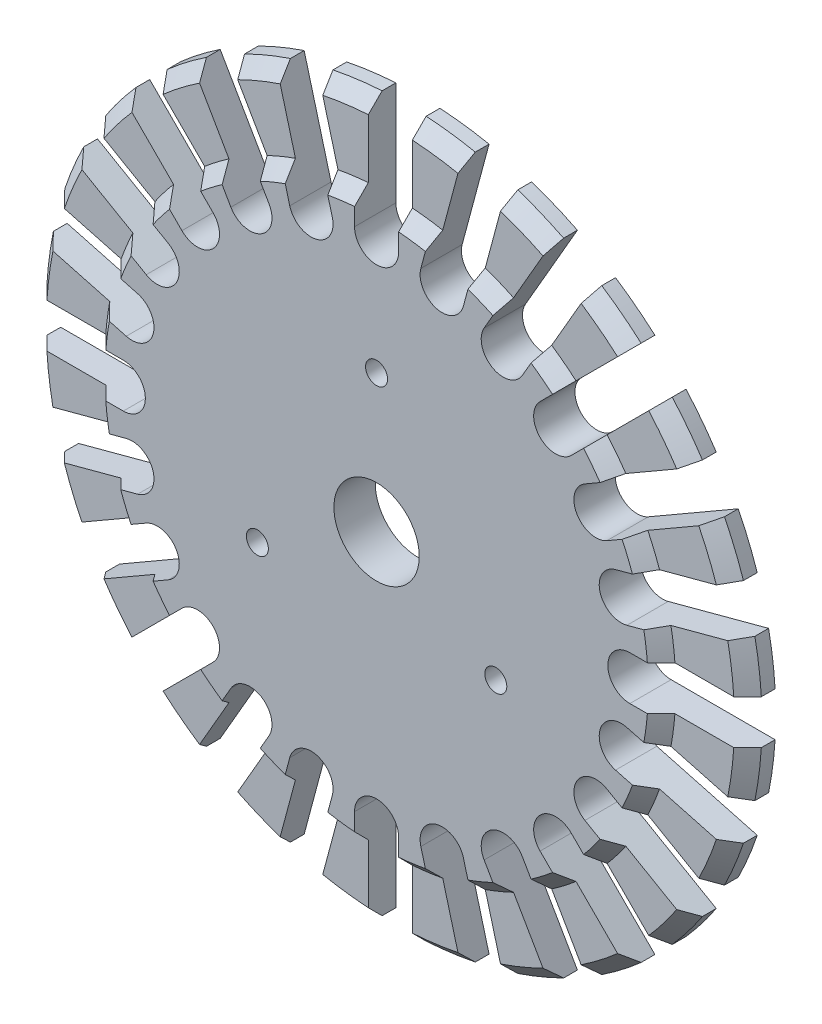
from build123d import *

# Parameters (mm, degrees)
ESBO_O1_R                = 26
RESSALTO_EXTRUS_O1_DEPTH = 2
CORTE_EXTRUS_O1_DEPTH    = 37.823905279
ESBO_O8_R                = 20.736193701
RESSALTO_EXTRUS_O2_DEPTH = 1
CORTE_EXTRUS_O2_DEPTH    = 37.754319474
ESBO_O10_R               = 3.1
CORTE_EXTRUS_O3_DEPTH    = 37.822275867
FURO_ROSCADO_DE_M21_D    = 1.6
ESBO_O23_R               = 33.041855185
CORTE_EXTRUS_O4_DEPTH    = 37.754319474


with BuildPart() as part:
    # Esboço1 → Ressalto-extrusão1 (new body)
    with BuildSketch(Plane.XY):
        Circle(ESBO_O1_R)
    extrude(amount=RESSALTO_EXTRUS_O1_DEPTH)

    # Chanfro1: read off the stored shape, not the designer's step
    # Chanfro1 outline → Chanfro1 (revolve, cut)
    with BuildSketch(Plane.XZ):
        Polygon((26, 2), (25, 2), (26, 1), align=None)
    revolve(axis=Axis((0, 0, 0), (0, 0, 1)), mode=Mode.SUBTRACT)

    # Esboço3 → Corte-extrusão1 (cut, through all)
    with BuildSketch(Plane(origin=(0, 0, 0), x_dir=(-1, 0, 0), z_dir=(0, 0, -1))):
        with BuildLine():
            ThreePointArc((18.4, 1.6), (16.8, 0), (18.4, -1.6))
            Line((18.4, -1.6), (25.950722533, -1.6))
            ThreePointArc((25.950722533, -1.6), (25.987677713, -0.800379327), (26, 0))
            ThreePointArc((26, 0), (25.987677713, 0.800379327), (25.950722533, 1.6))
            Line((25.950722533, 1.6), (18.4, 1.6))
        make_face()
        with BuildLine():
            ThreePointArc((24.652362634, -8.262022548), (25.114071484, -6.729295173), (25.480583578, -5.171059904))
            Line((25.480583578, -5.171059904), (18.187145676, -3.216789108))
            ThreePointArc((18.187145676, -3.216789108), (16.227553882, -4.348159958), (17.358924732, -6.307751752))
            Line((17.358924732, -6.307751752), (24.652362634, -8.262022548))
        make_face()
        with BuildLine():
            ThreePointArc((21.67398496, -14.361001913), (22.516660498, -13), (23.27398496, -11.589720621))
            Line((23.27398496, -11.589720621), (16.73486743, -7.814359354))
            ThreePointArc((16.73486743, -7.814359354), (14.549226784, -8.4), (15.13486743, -10.585640646))
            Line((15.13486743, -10.585640646), (21.67398496, -14.361001913))
        make_face()
        with BuildLine():
            ThreePointArc((17.21856103, -19.48130273), (18.384776311, -18.384776311), (19.48130273, -17.21856103))
            Line((19.48130273, -17.21856103), (14.142135624, -11.879393924))
            ThreePointArc((14.142135624, -11.879393924), (11.879393924, -11.879393924), (11.879393924, -14.142135624))
            Line((11.879393924, -14.142135624), (17.21856103, -19.48130273))
        make_face()
        with BuildLine():
            ThreePointArc((11.589720621, -23.27398496), (13, -22.516660498), (14.361001913, -21.67398496))
            Line((14.361001913, -21.67398496), (10.585640646, -15.13486743))
            ThreePointArc((10.585640646, -15.13486743), (8.4, -14.549226784), (7.814359354, -16.73486743))
            Line((7.814359354, -16.73486743), (11.589720621, -23.27398496))
        make_face()
        with BuildLine():
            ThreePointArc((5.171059904, -25.480583578), (6.729295173, -25.114071484), (8.262022548, -24.652362634))
            Line((8.262022548, -24.652362634), (6.307751752, -17.358924732))
            ThreePointArc((6.307751752, -17.358924732), (4.348159958, -16.227553882), (3.216789108, -18.187145676))
            Line((3.216789108, -18.187145676), (5.171059904, -25.480583578))
        make_face()
        with BuildLine():
            ThreePointArc((-1.6, -25.950722533), (0, -26), (1.6, -25.950722533))
            Line((1.6, -25.950722533), (1.6, -18.4))
            ThreePointArc((1.6, -18.4), (0, -16.8), (-1.6, -18.4))
            Line((-1.6, -18.4), (-1.6, -25.950722533))
        make_face()
        with BuildLine():
            ThreePointArc((-8.262022548, -24.652362634), (-6.729295173, -25.114071484), (-5.171059904, -25.480583578))
            Line((-5.171059904, -25.480583578), (-3.216789108, -18.187145676))
            ThreePointArc((-3.216789108, -18.187145676), (-4.348159958, -16.227553882), (-6.307751752, -17.358924732))
            Line((-6.307751752, -17.358924732), (-8.262022548, -24.652362634))
        make_face()
        with BuildLine():
            ThreePointArc((-14.361001913, -21.67398496), (-13, -22.516660498), (-11.589720621, -23.27398496))
            Line((-11.589720621, -23.27398496), (-7.814359354, -16.73486743))
            ThreePointArc((-7.814359354, -16.73486743), (-8.4, -14.549226784), (-10.585640646, -15.13486743))
            Line((-10.585640646, -15.13486743), (-14.361001913, -21.67398496))
        make_face()
        with BuildLine():
            ThreePointArc((-19.48130273, -17.21856103), (-18.384776311, -18.384776311), (-17.21856103, -19.48130273))
            Line((-17.21856103, -19.48130273), (-11.879393924, -14.142135624))
            ThreePointArc((-11.879393924, -14.142135624), (-11.879393924, -11.879393924), (-14.142135624, -11.879393924))
            Line((-14.142135624, -11.879393924), (-19.48130273, -17.21856103))
        make_face()
        with BuildLine():
            ThreePointArc((-23.27398496, -11.589720621), (-22.516660498, -13), (-21.67398496, -14.361001913))
            Line((-21.67398496, -14.361001913), (-15.13486743, -10.585640646))
            ThreePointArc((-15.13486743, -10.585640646), (-14.549226784, -8.4), (-16.73486743, -7.814359354))
            Line((-16.73486743, -7.814359354), (-23.27398496, -11.589720621))
        make_face()
        with BuildLine():
            ThreePointArc((-25.480583578, -5.171059904), (-25.114071484, -6.729295173), (-24.652362634, -8.262022548))
            Line((-24.652362634, -8.262022548), (-17.358924732, -6.307751752))
            ThreePointArc((-17.358924732, -6.307751752), (-16.227553882, -4.348159958), (-18.187145676, -3.216789108))
            Line((-18.187145676, -3.216789108), (-25.480583578, -5.171059904))
        make_face()
        with BuildLine():
            ThreePointArc((-25.950722533, 1.6), (-26, 0), (-25.950722533, -1.6))
            Line((-25.950722533, -1.6), (-18.4, -1.6))
            ThreePointArc((-18.4, -1.6), (-16.8, 0), (-18.4, 1.6))
            Line((-18.4, 1.6), (-25.950722533, 1.6))
        make_face()
        with BuildLine():
            Line((-15.13486743, 10.585640646), (-21.67398496, 14.361001913))
            ThreePointArc((-21.67398496, 14.361001913), (-22.516660498, 13), (-23.27398496, 11.589720621))
            Line((-23.27398496, 11.589720621), (-16.73486743, 7.814359354))
            ThreePointArc((-16.73486743, 7.814359354), (-14.549226784, 8.4), (-15.13486743, 10.585640646))
        make_face()
        with BuildLine():
            Line((-17.358924732, 6.307751752), (-24.652362634, 8.262022548))
            ThreePointArc((-24.652362634, 8.262022548), (-25.114071484, 6.729295173), (-25.480583578, 5.171059904))
            Line((-25.480583578, 5.171059904), (-18.187145676, 3.216789108))
            ThreePointArc((-18.187145676, 3.216789108), (-16.227553882, 4.348159958), (-17.358924732, 6.307751752))
        make_face()
        with BuildLine():
            Line((-11.879393924, 14.142135624), (-17.21856103, 19.48130273))
            ThreePointArc((-17.21856103, 19.48130273), (-18.384776311, 18.384776311), (-19.48130273, 17.21856103))
            Line((-19.48130273, 17.21856103), (-14.142135624, 11.879393924))
            ThreePointArc((-14.142135624, 11.879393924), (-11.879393924, 11.879393924), (-11.879393924, 14.142135624))
        make_face()
        with BuildLine():
            Line((-7.814359354, 16.73486743), (-11.589720621, 23.27398496))
            ThreePointArc((-11.589720621, 23.27398496), (-13, 22.516660498), (-14.361001913, 21.67398496))
            Line((-14.361001913, 21.67398496), (-10.585640646, 15.13486743))
            ThreePointArc((-10.585640646, 15.13486743), (-8.4, 14.549226784), (-7.814359354, 16.73486743))
        make_face()
        with BuildLine():
            Line((1.6, 18.4), (1.6, 25.950722533))
            ThreePointArc((1.6, 25.950722533), (0, 26), (-1.6, 25.950722533))
            Line((-1.6, 25.950722533), (-1.6, 18.4))
            ThreePointArc((-1.6, 18.4), (0, 16.8), (1.6, 18.4))
        make_face()
        with BuildLine():
            Line((6.307751752, 17.358924732), (8.262022548, 24.652362634))
            ThreePointArc((8.262022548, 24.652362634), (6.729295173, 25.114071484), (5.171059904, 25.480583578))
            Line((5.171059904, 25.480583578), (3.216789108, 18.187145676))
            ThreePointArc((3.216789108, 18.187145676), (4.348159958, 16.227553882), (6.307751752, 17.358924732))
        make_face()
        with BuildLine():
            Line((10.585640646, 15.13486743), (14.361001913, 21.67398496))
            ThreePointArc((14.361001913, 21.67398496), (13, 22.516660498), (11.589720621, 23.27398496))
            Line((11.589720621, 23.27398496), (7.814359354, 16.73486743))
            ThreePointArc((7.814359354, 16.73486743), (8.4, 14.549226784), (10.585640646, 15.13486743))
        make_face()
        with BuildLine():
            Line((14.142135624, 11.879393924), (19.48130273, 17.21856103))
            ThreePointArc((19.48130273, 17.21856103), (18.384776311, 18.384776311), (17.21856103, 19.48130273))
            Line((17.21856103, 19.48130273), (11.879393924, 14.142135624))
            ThreePointArc((11.879393924, 14.142135624), (11.879393924, 11.879393924), (14.142135624, 11.879393924))
        make_face()
        with BuildLine():
            Line((18.187145676, 3.216789108), (25.480583578, 5.171059904))
            ThreePointArc((25.480583578, 5.171059904), (25.114071484, 6.729295173), (24.652362634, 8.262022548))
            Line((24.652362634, 8.262022548), (17.358924732, 6.307751752))
            ThreePointArc((17.358924732, 6.307751752), (16.227553882, 4.348159958), (18.187145676, 3.216789108))
        make_face()
        with BuildLine():
            Line((16.73486743, 7.814359354), (23.27398496, 11.589720621))
            ThreePointArc((23.27398496, 11.589720621), (22.516660498, 13), (21.67398496, 14.361001913))
            Line((21.67398496, 14.361001913), (15.13486743, 10.585640646))
            ThreePointArc((15.13486743, 10.585640646), (14.549226784, 8.4), (16.73486743, 7.814359354))
        make_face()
        with BuildLine():
            Line((-3.216789108, 18.187145676), (-5.171059904, 25.480583578))
            ThreePointArc((-5.171059904, 25.480583578), (-6.729295173, 25.114071484), (-8.262022548, 24.652362634))
            Line((-8.262022548, 24.652362634), (-6.307751752, 17.358924732))
            ThreePointArc((-6.307751752, 17.358924732), (-4.348159958, 16.227553882), (-3.216789108, 18.187145676))
        make_face()
    extrude(amount=-CORTE_EXTRUS_O1_DEPTH, mode=Mode.SUBTRACT)

    # Esboço8 → Ressalto-extrusão2 (add)
    with BuildSketch(Plane.XY.offset(2)):
        with Locations(Location((0, 0, 0), (0, 0, 175.574672098))):
            Circle(ESBO_O8_R)
    extrude(amount=RESSALTO_EXTRUS_O2_DEPTH)

    # Chanfro2: read off the stored shape, not the designer's step
    # Chanfro2 outline → Chanfro2 (revolve, cut)
    with BuildSketch(Plane.XZ):
        Polygon((20.736193701, 3), (19.736193701, 3), (20.736193701, 2), align=None)
    revolve(axis=Axis((0, 0, 0), (0, 0, 1)), mode=Mode.SUBTRACT)

    # Esboço9 → Corte-extrusão2 (cut, through all)
    with BuildSketch(Plane(origin=(0, 0, 2), x_dir=(-1, 0, 0), z_dir=(0, 0, -1))):
        with BuildLine():
            ThreePointArc((-11.722827512, -17.104532859), (-9.537186866, -16.518892213), (-8.95154622, -18.704532859))
            ThreePointArc((-8.95154622, -18.704532859), (-10.36809685, -17.958070523), (-11.722827512, -17.104532859))
        make_face()
        with BuildLine():
            ThreePointArc((-15.750360712, -13.487619013), (-13.487619013, -13.487619013), (-13.487619013, -15.750360712))
            ThreePointArc((-13.487619013, -15.750360712), (-14.662703182, -14.662703182), (-15.750360712, -13.487619013))
        make_face()
        with BuildLine():
            ThreePointArc((-18.704532859, -8.95154622), (-16.518892213, -9.537186866), (-17.104532859, -11.722827512))
            ThreePointArc((-17.104532859, -11.722827512), (-17.958070523, -10.36809685), (-18.704532859, -8.95154622))
        make_face()
        with BuildLine():
            ThreePointArc((-20.384022002, -3.805440345), (-18.424430208, -4.936811195), (-19.555801058, -6.896402989))
            ThreePointArc((-19.555801058, -6.896402989), (-20.029625035, -5.366921853), (-20.384022002, -3.805440345))
        make_face()
        with BuildLine():
            ThreePointArc((-20.674373732, 1.6), (-19.074373732, 0), (-20.674373732, -1.6))
            ThreePointArc((-20.674373732, -1.6), (-20.736193701, 0), (-20.674373732, 1.6))
        make_face()
        with BuildLine():
            ThreePointArc((-19.555801058, 6.896402989), (-18.424430208, 4.936811195), (-20.384022002, 3.805440345))
            ThreePointArc((-20.384022002, 3.805440345), (-20.029625035, 5.366921853), (-19.555801058, 6.896402989))
        make_face()
        with BuildLine():
            ThreePointArc((-17.104532859, 11.722827512), (-16.518892213, 9.537186866), (-18.704532859, 8.95154622))
            ThreePointArc((-18.704532859, 8.95154622), (-17.958070523, 10.36809685), (-17.104532859, 11.722827512))
        make_face()
        with BuildLine():
            ThreePointArc((-13.487619013, 15.750360712), (-13.487619013, 13.487619013), (-15.750360712, 13.487619013))
            ThreePointArc((-15.750360712, 13.487619013), (-14.662703182, 14.662703182), (-13.487619013, 15.750360712))
        make_face()
        with BuildLine():
            ThreePointArc((-8.95154622, 18.704532859), (-9.537186866, 16.518892213), (-11.722827512, 17.104532859))
            ThreePointArc((-11.722827512, 17.104532859), (-10.36809685, 17.958070523), (-8.95154622, 18.704532859))
        make_face()
        with BuildLine():
            ThreePointArc((-3.805440345, 20.384022002), (-4.936811195, 18.424430208), (-6.896402989, 19.555801058))
            ThreePointArc((-6.896402989, 19.555801058), (-5.366921853, 20.029625035), (-3.805440345, 20.384022002))
        make_face()
        with BuildLine():
            ThreePointArc((1.6, 20.674373732), (0, 19.074373732), (-1.6, 20.674373732))
            ThreePointArc((-1.6, 20.674373732), (0, 20.736193701), (1.6, 20.674373732))
        make_face()
        with BuildLine():
            ThreePointArc((6.896402989, 19.555801058), (4.936811195, 18.424430208), (3.805440345, 20.384022002))
            ThreePointArc((3.805440345, 20.384022002), (5.366921853, 20.029625035), (6.896402989, 19.555801058))
        make_face()
        with BuildLine():
            ThreePointArc((11.722827512, 17.104532859), (9.537186866, 16.518892213), (8.95154622, 18.704532859))
            ThreePointArc((8.95154622, 18.704532859), (10.36809685, 17.958070523), (11.722827512, 17.104532859))
        make_face()
        with BuildLine():
            ThreePointArc((15.750360712, 13.487619013), (13.487619013, 13.487619013), (13.487619013, 15.750360712))
            ThreePointArc((13.487619013, 15.750360712), (14.662703182, 14.662703182), (15.750360712, 13.487619013))
        make_face()
        with BuildLine():
            ThreePointArc((18.704532859, 8.95154622), (16.518892213, 9.537186866), (17.104532859, 11.722827512))
            ThreePointArc((17.104532859, 11.722827512), (17.958070523, 10.36809685), (18.704532859, 8.95154622))
        make_face()
        with BuildLine():
            ThreePointArc((20.384022002, 3.805440345), (18.424430208, 4.936811195), (19.555801058, 6.896402989))
            ThreePointArc((19.555801058, 6.896402989), (20.029625035, 5.366921853), (20.384022002, 3.805440345))
        make_face()
        with BuildLine():
            ThreePointArc((20.674373732, -1.6), (19.074373732, 0), (20.674373732, 1.6))
            ThreePointArc((20.674373732, 1.6), (20.736193701, 0), (20.674373732, -1.6))
        make_face()
        with BuildLine():
            ThreePointArc((19.555801058, -6.896402989), (18.424430208, -4.936811195), (20.384022002, -3.805440345))
            ThreePointArc((20.384022002, -3.805440345), (20.029625035, -5.366921853), (19.555801058, -6.896402989))
        make_face()
        with BuildLine():
            ThreePointArc((17.104532859, -11.722827512), (16.518892213, -9.537186866), (18.704532859, -8.95154622))
            ThreePointArc((18.704532859, -8.95154622), (17.958070523, -10.36809685), (17.104532859, -11.722827512))
        make_face()
        with BuildLine():
            ThreePointArc((13.487619013, -15.750360712), (13.487619013, -13.487619013), (15.750360712, -13.487619013))
            ThreePointArc((15.750360712, -13.487619013), (14.662703182, -14.662703182), (13.487619013, -15.750360712))
        make_face()
        with BuildLine():
            ThreePointArc((8.95154622, -18.704532859), (9.537186866, -16.518892213), (11.722827512, -17.104532859))
            ThreePointArc((11.722827512, -17.104532859), (10.36809685, -17.958070523), (8.95154622, -18.704532859))
        make_face()
        with BuildLine():
            ThreePointArc((3.805440345, -20.384022002), (4.936811195, -18.424430208), (6.896402989, -19.555801058))
            ThreePointArc((6.896402989, -19.555801058), (5.366921853, -20.029625035), (3.805440345, -20.384022002))
        make_face()
        with BuildLine():
            ThreePointArc((-1.6, -20.674373732), (0, -19.074373732), (1.6, -20.674373732))
            ThreePointArc((1.6, -20.674373732), (0, -20.736193701), (-1.6, -20.674373732))
        make_face()
        with BuildLine():
            ThreePointArc((-6.896402989, -19.555801058), (-4.936811195, -18.424430208), (-3.805440345, -20.384022002))
            ThreePointArc((-3.805440345, -20.384022002), (-5.366921853, -20.029625035), (-6.896402989, -19.555801058))
        make_face()
    extrude(amount=-CORTE_EXTRUS_O2_DEPTH, mode=Mode.SUBTRACT)

    # Esboço10 → Corte-extrusão3 (cut, through all)
    with BuildSketch(Plane.XY.offset(3)):
        Circle(ESBO_O10_R)
    extrude(amount=-CORTE_EXTRUS_O3_DEPTH, mode=Mode.SUBTRACT)

    # Furo roscado de M21 (through all)
    with Locations(Plane(origin=(-8.660254038, -5, 3), x_dir=(1, 0, 0), z_dir=(0, 0, 1))):
        with Locations((0, 0), (8.660254038, 15), (17.320508076, 0)):
            Hole(FURO_ROSCADO_DE_M21_D / 2)

    # Esboço23 → Corte-extrusão4 (cut, through all)
    with BuildSketch(Plane(origin=(0, 0, 2), x_dir=(-1, 0, 0), z_dir=(0, 0, -1))):
        Circle(ESBO_O23_R)
        with BuildLine():
            Line((-18.187145676, 3.216789108), (-25.480583578, 5.171059904))
            ThreePointArc((-25.480583578, 5.171059904), (-25.777566396, 3.393680998), (-25.950722533, 1.6))
            Line((-25.950722533, 1.6), (-18.4, 1.6))
            ThreePointArc((-18.4, 1.6), (-16.8, 0), (-18.4, -1.6))
            Line((-18.4, -1.6), (-25.950722533, -1.6))
            ThreePointArc((-25.950722533, -1.6), (-25.777566396, -3.393680998), (-25.480583578, -5.171059904))
            Line((-25.480583578, -5.171059904), (-18.187145676, -3.216789108))
            ThreePointArc((-18.187145676, -3.216789108), (-16.227553882, -4.348159958), (-17.358924732, -6.307751752))
            Line((-17.358924732, -6.307751752), (-24.652362634, -8.262022548))
            ThreePointArc((-24.652362634, -8.262022548), (-24.020867845, -9.949769241), (-23.27398496, -11.589720621))
            Line((-23.27398496, -11.589720621), (-16.73486743, -7.814359354))
            ThreePointArc((-16.73486743, -7.814359354), (-14.549226784, -8.4), (-15.13486743, -10.585640646))
            Line((-15.13486743, -10.585640646), (-21.67398496, -14.361001913))
            ThreePointArc((-21.67398496, -14.361001913), (-20.627186848, -15.827797154), (-19.48130273, -17.21856103))
            Line((-19.48130273, -17.21856103), (-14.142135624, -11.879393924))
            ThreePointArc((-14.142135624, -11.879393924), (-11.879393924, -11.879393924), (-11.879393924, -14.142135624))
            Line((-11.879393924, -14.142135624), (-17.21856103, -19.48130273))
            ThreePointArc((-17.21856103, -19.48130273), (-15.827797154, -20.627186848), (-14.361001913, -21.67398496))
            Line((-14.361001913, -21.67398496), (-10.585640646, -15.13486743))
            ThreePointArc((-10.585640646, -15.13486743), (-8.4, -14.549226784), (-7.814359354, -16.73486743))
            Line((-7.814359354, -16.73486743), (-11.589720621, -23.27398496))
            ThreePointArc((-11.589720621, -23.27398496), (-9.949769241, -24.020867845), (-8.262022548, -24.652362634))
            Line((-8.262022548, -24.652362634), (-6.307751752, -17.358924732))
            ThreePointArc((-6.307751752, -17.358924732), (-4.348159958, -16.227553882), (-3.216789108, -18.187145676))
            Line((-3.216789108, -18.187145676), (-5.171059904, -25.480583578))
            ThreePointArc((-5.171059904, -25.480583578), (-3.393680998, -25.777566396), (-1.6, -25.950722533))
            Line((-1.6, -25.950722533), (-1.6, -18.4))
            ThreePointArc((-1.6, -18.4), (0, -16.8), (1.6, -18.4))
            Line((1.6, -18.4), (1.6, -25.950722533))
            ThreePointArc((1.6, -25.950722533), (3.393680998, -25.777566396), (5.171059904, -25.480583578))
            Line((5.171059904, -25.480583578), (3.216789108, -18.187145676))
            ThreePointArc((3.216789108, -18.187145676), (4.348159958, -16.227553882), (6.307751752, -17.358924732))
            Line((6.307751752, -17.358924732), (8.262022548, -24.652362634))
            ThreePointArc((8.262022548, -24.652362634), (9.949769241, -24.020867845), (11.589720621, -23.27398496))
            Line((11.589720621, -23.27398496), (7.814359354, -16.73486743))
            ThreePointArc((7.814359354, -16.73486743), (8.4, -14.549226784), (10.585640646, -15.13486743))
            Line((10.585640646, -15.13486743), (14.361001913, -21.67398496))
            ThreePointArc((14.361001913, -21.67398496), (15.827797154, -20.627186848), (17.21856103, -19.48130273))
            Line((17.21856103, -19.48130273), (11.879393924, -14.142135624))
            ThreePointArc((11.879393924, -14.142135624), (11.879393924, -11.879393924), (14.142135624, -11.879393924))
            Line((14.142135624, -11.879393924), (19.48130273, -17.21856103))
            ThreePointArc((19.48130273, -17.21856103), (20.627186848, -15.827797154), (21.67398496, -14.361001913))
            Line((21.67398496, -14.361001913), (15.13486743, -10.585640646))
            ThreePointArc((15.13486743, -10.585640646), (14.549226784, -8.4), (16.73486743, -7.814359354))
            Line((16.73486743, -7.814359354), (23.27398496, -11.589720621))
            ThreePointArc((23.27398496, -11.589720621), (24.020867845, -9.949769241), (24.652362634, -8.262022548))
            Line((24.652362634, -8.262022548), (17.358924732, -6.307751752))
            ThreePointArc((17.358924732, -6.307751752), (16.227553882, -4.348159958), (18.187145676, -3.216789108))
            Line((18.187145676, -3.216789108), (25.480583578, -5.171059904))
            ThreePointArc((25.480583578, -5.171059904), (25.777566396, -3.393680998), (25.950722533, -1.6))
            Line((25.950722533, -1.6), (18.4, -1.6))
            ThreePointArc((18.4, -1.6), (16.8, 0), (18.4, 1.6))
            Line((18.4, 1.6), (25.950722533, 1.6))
            ThreePointArc((25.950722533, 1.6), (25.777566396, 3.393680998), (25.480583578, 5.171059904))
            Line((25.480583578, 5.171059904), (18.187145676, 3.216789108))
            ThreePointArc((18.187145676, 3.216789108), (16.227553882, 4.348159958), (17.358924732, 6.307751752))
            Line((17.358924732, 6.307751752), (24.652362634, 8.262022548))
            ThreePointArc((24.652362634, 8.262022548), (24.020867845, 9.949769241), (23.27398496, 11.589720621))
            Line((23.27398496, 11.589720621), (16.73486743, 7.814359354))
            ThreePointArc((16.73486743, 7.814359354), (14.549226784, 8.4), (15.13486743, 10.585640646))
            Line((15.13486743, 10.585640646), (21.67398496, 14.361001913))
            ThreePointArc((21.67398496, 14.361001913), (20.627186848, 15.827797154), (19.48130273, 17.21856103))
            Line((19.48130273, 17.21856103), (14.142135624, 11.879393924))
            ThreePointArc((14.142135624, 11.879393924), (11.879393924, 11.879393924), (11.879393924, 14.142135624))
            Line((11.879393924, 14.142135624), (17.21856103, 19.48130273))
            ThreePointArc((17.21856103, 19.48130273), (15.827797154, 20.627186848), (14.361001913, 21.67398496))
            Line((14.361001913, 21.67398496), (10.585640646, 15.13486743))
            ThreePointArc((10.585640646, 15.13486743), (8.4, 14.549226784), (7.814359354, 16.73486743))
            Line((7.814359354, 16.73486743), (11.589720621, 23.27398496))
            ThreePointArc((11.589720621, 23.27398496), (9.949769241, 24.020867845), (8.262022548, 24.652362634))
            Line((8.262022548, 24.652362634), (6.307751752, 17.358924732))
            ThreePointArc((6.307751752, 17.358924732), (4.348159958, 16.227553882), (3.216789108, 18.187145676))
            Line((3.216789108, 18.187145676), (5.171059904, 25.480583578))
            ThreePointArc((5.171059904, 25.480583578), (3.393680998, 25.777566396), (1.6, 25.950722533))
            Line((1.6, 25.950722533), (1.6, 18.4))
            ThreePointArc((1.6, 18.4), (0, 16.8), (-1.6, 18.4))
            Line((-1.6, 18.4), (-1.6, 25.950722533))
            ThreePointArc((-1.6, 25.950722533), (-3.393680998, 25.777566396), (-5.171059904, 25.480583578))
            Line((-5.171059904, 25.480583578), (-3.216789108, 18.187145676))
            ThreePointArc((-3.216789108, 18.187145676), (-4.348159958, 16.227553882), (-6.307751752, 17.358924732))
            Line((-6.307751752, 17.358924732), (-8.262022548, 24.652362634))
            ThreePointArc((-8.262022548, 24.652362634), (-9.949769241, 24.020867845), (-11.589720621, 23.27398496))
            Line((-11.589720621, 23.27398496), (-7.814359354, 16.73486743))
            ThreePointArc((-7.814359354, 16.73486743), (-8.4, 14.549226784), (-10.585640646, 15.13486743))
            Line((-10.585640646, 15.13486743), (-14.361001913, 21.67398496))
            ThreePointArc((-14.361001913, 21.67398496), (-15.827797154, 20.627186848), (-17.21856103, 19.48130273))
            Line((-17.21856103, 19.48130273), (-11.879393924, 14.142135624))
            ThreePointArc((-11.879393924, 14.142135624), (-11.879393924, 11.879393924), (-14.142135624, 11.879393924))
            Line((-14.142135624, 11.879393924), (-19.48130273, 17.21856103))
            ThreePointArc((-19.48130273, 17.21856103), (-20.627186848, 15.827797154), (-21.67398496, 14.361001913))
            Line((-21.67398496, 14.361001913), (-15.13486743, 10.585640646))
            ThreePointArc((-15.13486743, 10.585640646), (-14.549226784, 8.4), (-16.73486743, 7.814359354))
            Line((-16.73486743, 7.814359354), (-23.27398496, 11.589720621))
            ThreePointArc((-23.27398496, 11.589720621), (-24.020867845, 9.949769241), (-24.652362634, 8.262022548))
            Line((-24.652362634, 8.262022548), (-17.358924732, 6.307751752))
            ThreePointArc((-17.358924732, 6.307751752), (-16.227553882, 4.348159958), (-18.187145676, 3.216789108))
        make_face(mode=Mode.SUBTRACT)
    extrude(amount=-CORTE_EXTRUS_O4_DEPTH, mode=Mode.SUBTRACT)


solid = part.part
